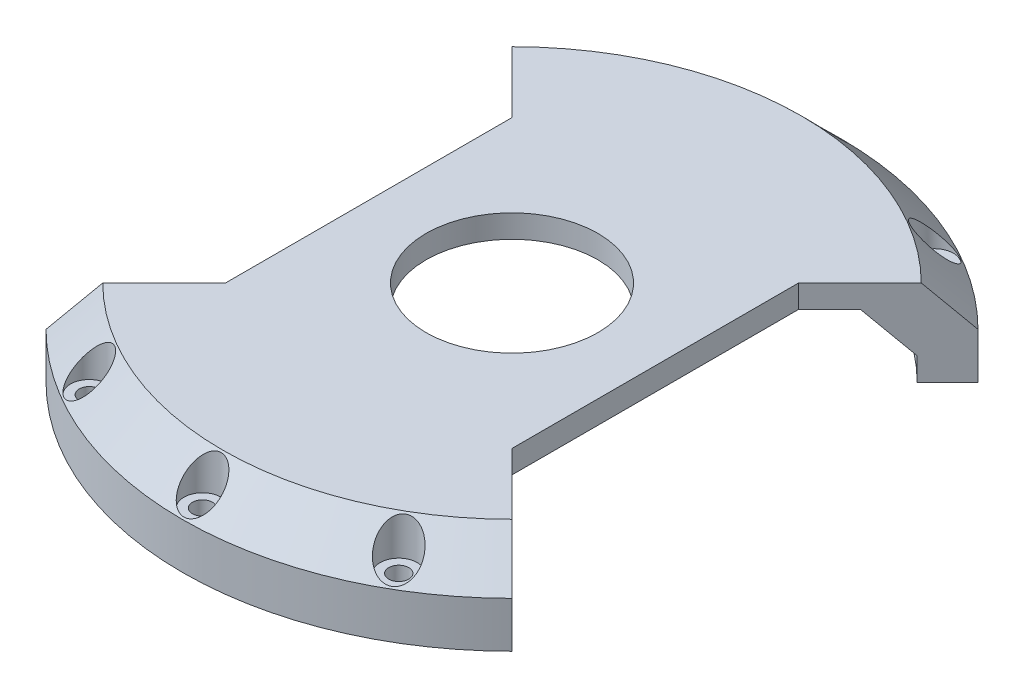
from build123d import *

# Parameters (mm, degrees)
SKETCH1_R           = 57.5
BOSS_EXTRUDE1_DEPTH = 15
SKETCH2_R           = 50
CUT_EXTRUDE1_DEPTH  = 11
SKETCH3_R           = 1.75
SKETCH3_R_2         = 15
CUT_EXTRUDE2_DEPTH  = 15
CUT_EXTRUDE3_START  = -15
CUT_EXTRUDE3_DEPTH  = 15
CHAMFER1_SIZE       = 7
SKETCH5_R           = 3.25
CUT_EXTRUDE4_DEPTH  = 7


with BuildPart() as part:
    # Sketch1 → Boss-Extrude1 (new body)
    with BuildSketch(Plane(origin=(0, 0, 0), x_dir=(1, 0, 0), z_dir=(0, 1, 0))):
        with Locations(Location((0, 0, 0), (0, 0, 270))):
            Circle(SKETCH1_R)
    extrude(amount=BOSS_EXTRUDE1_DEPTH)

    # Sketch2 → Cut-Extrude1 (cut)
    with BuildSketch(Plane.XZ):
        with Locations(Location((0, 0, 0), (0, 0, 270))):
            Circle(SKETCH2_R)
    extrude(amount=-CUT_EXTRUDE1_DEPTH, mode=Mode.SUBTRACT)

    # Sketch3 → Cut-Extrude2 (cut)
    with BuildSketch(Plane(origin=(0, 15, 0), x_dir=(1, 0, 0), z_dir=(0, 1, 0))):
        with Locations(Location((0, 54, 0), (0, 0, 270))):
            Circle(SKETCH3_R)
        with Locations(Location((27, 46.765371804, 0), (0, 0, 270))):
            Circle(SKETCH3_R)
        with Locations(Location((46.765371804, 27, 0), (0, 0, 270))):
            Circle(SKETCH3_R)
        with Locations(Location((54, 0, 0), (0, 0, 270))):
            Circle(SKETCH3_R)
        with Locations(Location((46.765371804, -27, 0), (0, 0, 270))):
            Circle(SKETCH3_R)
        with Locations(Location((27, -46.765371804, 0), (0, 0, 270))):
            Circle(SKETCH3_R)
        with Locations(Location((0, -54, 0), (0, 0, 270))):
            Circle(SKETCH3_R)
        with Locations(Location((-27, -46.765371804, 0), (0, 0, 270))):
            Circle(SKETCH3_R)
        with Locations(Location((-46.765371804, -27, 0), (0, 0, 270))):
            Circle(SKETCH3_R)
        with Locations(Location((-54, 0, 0), (0, 0, 270))):
            Circle(SKETCH3_R)
        with Locations(Location((-46.765371804, 27, 0), (0, 0, 270))):
            Circle(SKETCH3_R)
        with Locations(Location((-27, 46.765371804, 0), (0, 0, 270))):
            Circle(SKETCH3_R)
        with Locations(Location((0, 0, 0), (0, 0, 270))):
            Circle(SKETCH3_R_2)
    extrude(amount=-CUT_EXTRUDE2_DEPTH, mode=Mode.SUBTRACT)

    # Sketch4 → Cut-Extrude3 (cut)
    with BuildSketch(Plane(origin=(0, 15, 0), x_dir=(1, 0, 0), z_dir=(0, 1, 0)).offset(CUT_EXTRUDE3_START)):
        with BuildLine():
            Line((25, 25), (40.658639918, 40.658639918))
            ThreePointArc((40.658639918, 40.658639918), (57.5, 0), (40.658639918, -40.658639918))
            Line((40.658639918, -40.658639918), (25, -25))
            Line((25, -25), (25, 25))
        make_face()
    cut_extrude3 = extrude(amount=CUT_EXTRUDE3_DEPTH, mode=Mode.SUBTRACT)

    # Mirror1: Cut-Extrude3 across plane
    add(cut_extrude3.mirror(Plane(origin=(0, 0, 0), x_dir=(0, 0, 1), z_dir=(1, 0, 0))), mode=Mode.SUBTRACT)

    # Chamfer1
    # the kernel refuses this chamfer: 7 mm, written as the material it adds along each edge
    with BuildSketch(Plane(origin=(0, 11, 0), x_dir=(-0.7071067811865476, 0, 0.7071067811865476), z_dir=(-0.7071067811865476, 0, -0.7071067811865476))) as chamfer1_piece_1:
        Polygon((50 - CHAMFER1_SIZE, 0), (50, -CHAMFER1_SIZE), (50, 0), align=None)
    revolve(axis=Axis((0, 11, 0), (0, 1, 0)), revolution_arc=90)
    with BuildSketch(Plane(origin=(0, 11, 0), x_dir=(0.7071067811865475, 0, -0.7071067811865477), z_dir=(0.7071067811865477, 0, 0.7071067811865475))) as chamfer1_piece_2:
        Polygon((50, -CHAMFER1_SIZE), (50 - CHAMFER1_SIZE, 0), (50, 0), align=None)
    revolve(axis=Axis((0, 11, 0), (0, 1, 0)), revolution_arc=90)
    # the kernel refuses this chamfer: 7 mm, written as the material it takes off along each edge
    with BuildSketch(Plane(origin=(0, 15, 0), x_dir=(-0.890570714861766, 0, -0.4548448107108656), z_dir=(-0.4548448107108656, 0, 0.890570714861766))) as chamfer1_2_piece_1:
        Polygon((57.5, CHAMFER1_SIZE), (57.5 - CHAMFER1_SIZE, 0), (57.5, 0), align=None)
    revolve(axis=Axis((0, 15, 0), (0, -1, 0)), revolution_arc=125.890100955, mode=Mode.SUBTRACT)
    with BuildSketch(Plane(origin=(0, 15, 0), x_dir=(0.890570714861766, 0, 0.4548448107108656), z_dir=(0.4548448107108656, 0, -0.890570714861766))) as chamfer1_2_piece_2:
        Polygon((57.5 - CHAMFER1_SIZE, 0), (57.5, CHAMFER1_SIZE), (57.5, 0), align=None)
    revolve(axis=Axis((0, 15, 0), (0, -1, 0)), revolution_arc=125.890100955, mode=Mode.SUBTRACT)

    # Sketch5 → Cut-Extrude4 (cut)
    with BuildSketch(Plane(origin=(0, 15, 0), x_dir=(1, 0, 0), z_dir=(0, 1, 0))):
        with Locations(Location((0, 54, 0), (0, 0, 270))):
            Circle(SKETCH5_R)
        with Locations(Location((27, 46.765371804, 0), (0, 0, 270))):
            Circle(SKETCH5_R)
        with Locations((46.765371804, 27)):
            Circle(SKETCH5_R)
        with Locations((54, 0)):
            Circle(SKETCH5_R)
        with Locations((46.765371804, -27)):
            Circle(SKETCH5_R)
        with Locations(Location((27, -46.765371804, 0), (0, 0, 270))):
            Circle(SKETCH5_R)
        with Locations(Location((0, -54, 0), (0, 0, 270))):
            Circle(SKETCH5_R)
        with Locations(Location((-27, -46.765371804, 0), (0, 0, 270))):
            Circle(SKETCH5_R)
        with Locations((-46.765371804, -27)):
            Circle(SKETCH5_R)
        with Locations((-54, 0)):
            Circle(SKETCH5_R)
        with Locations((-46.765371804, 27)):
            Circle(SKETCH5_R)
        with Locations(Location((-27, 46.765371804, 0), (0, 0, 270))):
            Circle(SKETCH5_R)
    extrude(amount=-CUT_EXTRUDE4_DEPTH, mode=Mode.SUBTRACT)


solid = part.part
